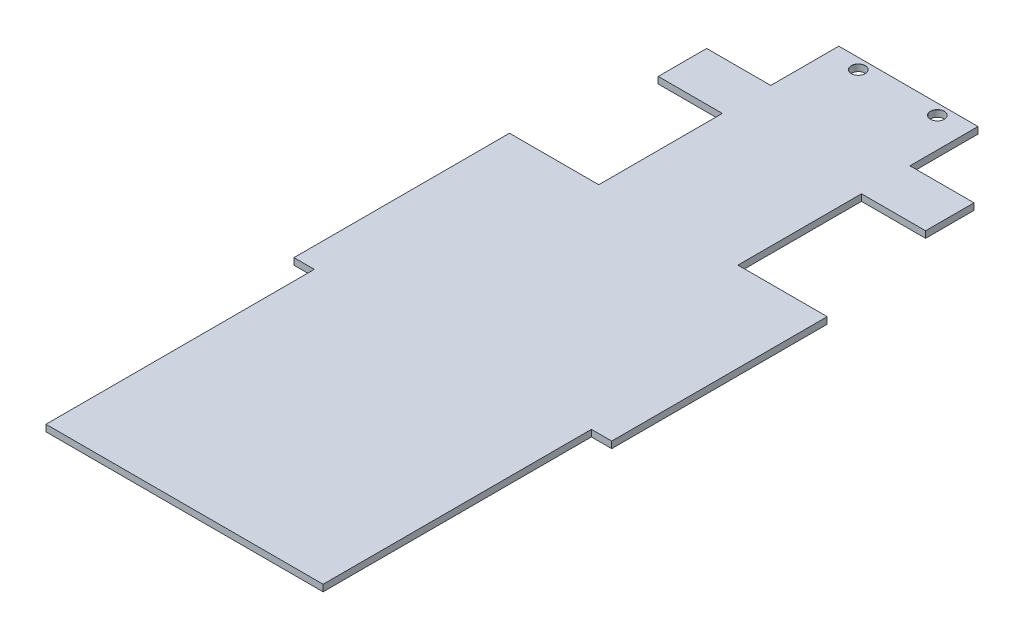
from build123d import *

# Parameters (mm, degrees)
BOSS_EXTRU_6_DEPTH          = 1.87
D_GAGEMENT_M3_52_AT_2_COUNT = 2
D_GAGEMENT_M3_52_AT_2_PITCH = 22.39


with BuildPart() as part:
    # Esquisse1 → Boss.-Extru.6 (new body)
    with BuildSketch(Plane(origin=(0, 0, 0), x_dir=(1, 0, 0), z_dir=(0, 1, 0))):
        Polygon((45, -30.525), (45, 30.525), (19.715, 30.525), (19.715, 65.525), (37.865, 65.525), (37.865, 79.245), (19.715, 79.245), (19.715, 98.525), (-19.715, 98.525), (-19.715, 79.245), (-37.865, 79.245), (-37.865, 65.525), (-19.715, 65.525), (-19.715, 30.525), (-45, 30.525), (-45, -30.525), (-39.25, -30.525), (-39.25, -106.525), (39.25, -106.525), (39.25, -30.525), align=None)
    extrude(amount=BOSS_EXTRU_6_DEPTH)

    # Esquisse6 → Dégagement M3.52 (revolve, cut)
    with BuildSketch(Plane(origin=(-11.195, 1.87, -95.525), x_dir=(0, 0, 1), z_dir=(1, 0, 0))):
        Polygon((0, 0), (0, 1.87), (1.95, 1.87), (1.95, 0.025), (1.975, 0), align=None)
    d_gagement_m3_52 = revolve(axis=Axis((-11.195, 8.22, -95.525), (0, -1, 0)), mode=Mode.SUBTRACT)

    # Dégagement M3.52 at 2: Dégagement M3.52 ×2
    with Locations(*[(i * D_GAGEMENT_M3_52_AT_2_PITCH, 0, 0) for i in range(1, D_GAGEMENT_M3_52_AT_2_COUNT)]):
        add(d_gagement_m3_52, mode=Mode.SUBTRACT)


solid = part.part
